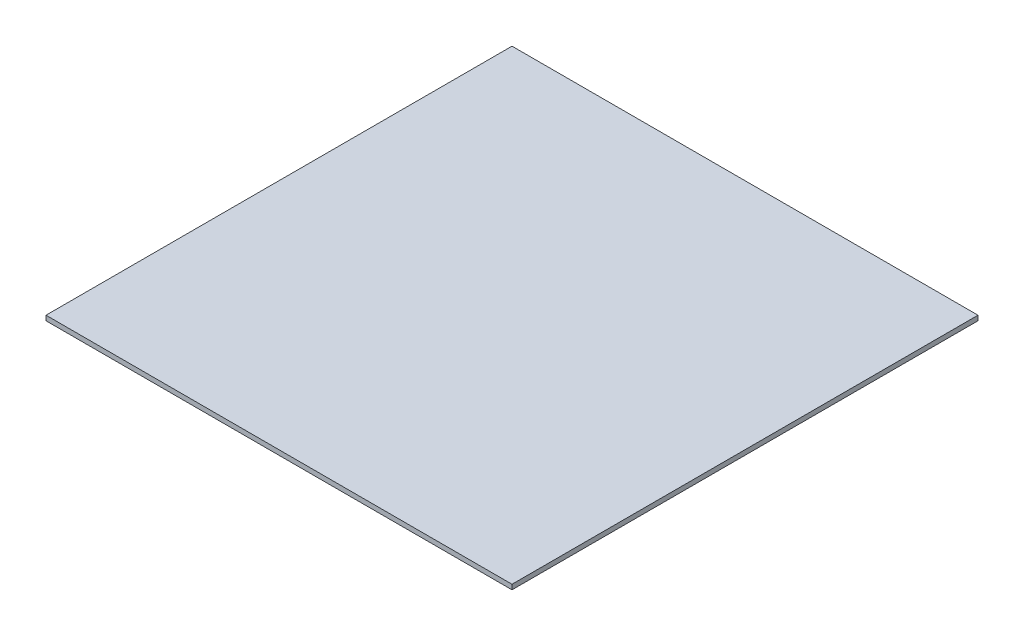
from build123d import *

# Parameters (mm, degrees)
SKETCH1_W           = 609.6
SKETCH1_H           = 609.6
BOSS_EXTRUDE1_DEPTH = 6.35


with BuildPart() as part:
    # Sketch1 → Boss-Extrude1 (new body)
    with BuildSketch(Plane(origin=(0, 0, 0), x_dir=(1, 0, 0), z_dir=(0, 1, 0))):
        with Locations((304.8, 304.8)):
            Rectangle(SKETCH1_W, SKETCH1_H)
    extrude(amount=BOSS_EXTRUDE1_DEPTH)


solid = part.part
